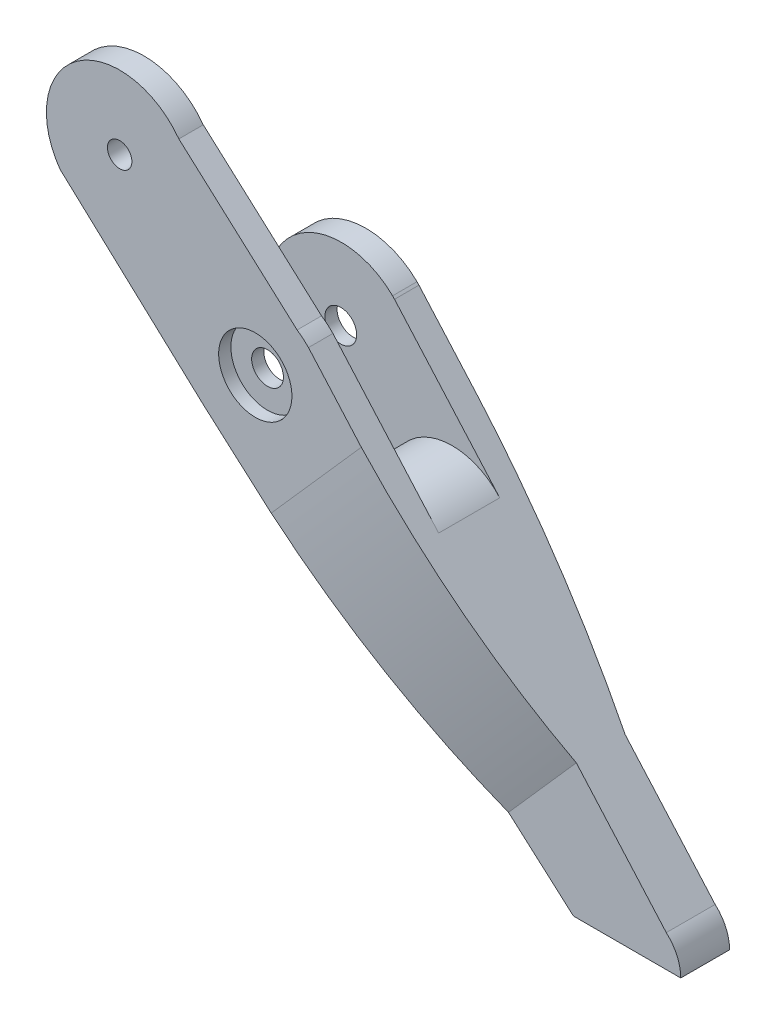
from build123d import *

# Parameters (mm, degrees)
BOSS_EXTRUDE1_DEPTH = 14
CUT_EXTRUDE1_DEPTH  = 17
CUT_EXTRUDE3_DEPTH  = 10
CUT_EXTRUDE5_DEPTH  = 28.00000000000001
BOSS_EXTRUDE2_START = 10
SKETCH7_R           = 2.599999999999999
BOSS_EXTRUDE2_DEPTH = 4
BOSS_EXTRUDE3_DEPTH = 24.000000000000014
CUT_EXTRUDE6_DEPTH  = 24.000000000000014
FILLET3_R           = 10.371224
SKETCH11_R          = 2.0000000000000036
BOSS_EXTRUDE4_DEPTH = 4.0000000000000036
SKETCH12_R          = 5.999999999999998
CUT_EXTRUDE7_DEPTH  = 2
CUT_EXTRUDE8_START  = -2
SKETCH13_R          = 6.000000000000001
CUT_EXTRUDE8_DEPTH  = 2


with BuildPart() as part:
    # Sketch1 → Boss-Extrude1 (new body)
    with BuildSketch(Plane.XY):
        with BuildLine():
            Line((-36.38946679579018, 35.15986129833476), (18.20052051694879, -13.03747639081095))
            Line((18.20052051694879, -13.03747639081095), (35.77692020217122, -13.037476390810937))
            ThreePointArc((35.77692020217122, -13.037476390810937), (35.15777812721451, -10.159169225075718), (33.40987673348322, -7.79002807961883))
            Line((33.40987673348322, -7.79002807961883), (-19.19377778956647, 51.90227090989418))
            ThreePointArc((-19.19377778956647, 51.90227090989418), (-36.16282709845803, 52.12891060722632), (-36.38946679579018, 35.15986129833476))
        make_face()
    extrude(amount=BOSS_EXTRUDE1_DEPTH)

    # Sketch2 → Cut-Extrude1 (cut)
    with BuildSketch(Plane.XY.offset(14)):
        with BuildLine():
            ThreePointArc((-26.066464510259447, 45.48286358386564), (-29.74341977242946, 45.48286358386556), (-29.74341977242945, 41.80590832169555))
            Line((-29.74341977242943, 41.80590832169553), (-26.066464510259397, 45.48286358386558))
        make_face()
        with BuildLine():
            Line((-26.066464510259397, 45.48286358386558), (-29.74341977242943, 41.80590832169553))
            ThreePointArc((-29.74341977242945, 41.805908321695554), (-26.90996521719519, 41.24229916825121), (-25.304942141344416, 43.64438595278056))
            ThreePointArc((-25.304942141344416, 43.64438595278056), (-25.502855356815083, 44.63936287692983), (-26.066464510259447, 45.48286358386564))
        make_face()
    extrude(amount=-CUT_EXTRUDE1_DEPTH, mode=Mode.SUBTRACT)

    # Sketch3 → Cut-Extrude3 (cut)
    with BuildSketch(Plane(origin=(0, 0, 0), x_dir=(-1, 0, 0), z_dir=(0, 0, -1))):
        Polygon((9.244950076252596, 40.61278154184911), (25.60190789451236, 23.944622093291866), (43.70935849975749, 23.944622093291866), (43.70935849975749, 56.22709716223903), (9.244950076252595, 56.22709716223903), align=None)
    extrude(amount=-CUT_EXTRUDE3_DEPTH, mode=Mode.SUBTRACT)

    # Sketch4 → Cut-Extrude5 (cut)
    with BuildSketch(Plane(origin=(1.5041731974177077, 1.7036790764832412, 0), x_dir=(0.7496354730351515, -0.6618509330410925, 0), z_dir=(-0.6618509330410925, -0.7496354730351515, 0))):
        with BuildLine():
            Line((8.092649067523661, 8), (43.108918661974144, 8))
            Line((43.108918661974144, 8), (43.108918661974144, 14))
            Line((43.108918661974144, 14), (-35.75655339767276, 14))
            add(Edge.make_bspline(
                [(8.092649067523661, 8), (-13.064100153172822, 13.584073422401662), (-35.75655339767276, 14)],
                knots=[0, 0, 0, 1, 1, 1], degree=2))
        make_face()
    extrude(amount=-CUT_EXTRUDE5_DEPTH, mode=Mode.SUBTRACT)



with BuildPart() as body_2:
    # Sketch7 → Boss-Extrude2 (new body)
    with BuildSketch(Plane(origin=(0, 0, 10), x_dir=(-1, 0, 0), z_dir=(0, 0, -1)).offset(BOSS_EXTRUDE2_START)):
        with BuildLine():
            Line((9.244950076252595, 40.61278154184911), (24.71284152511152, 24.85060352151197))
            Line((24.71284152511152, 24.85060352151197), (35.272794661727836, 34.17395478721706))
            Line((35.272794661727836, 34.17395478721706), (36.38946679579018, 35.15986129833476))
            ThreePointArc((36.38946679579018, 35.15986129833476), (36.27690366691708, 52.016347478352856), (19.420417486898984, 52.12891060722668))
            ThreePointArc((19.420417486898984, 52.128910607226686), (19.259089791001077, 51.96445532507904), (19.10094915036315, 51.79693307859034))
            Line((19.10094915036315, 51.79693307859034), (18.710021655268264, 51.3533258590539))
            Line((18.710021655268264, 51.3533258590539), (9.244950076252596, 40.61278154184911))
        make_face()
        with Locations(Location((27.904942141344414, 43.64438595278056, 0), (0, 0, 180))):
            Circle(SKETCH7_R, mode=Mode.SUBTRACT)
    extrude(amount=BOSS_EXTRUDE2_DEPTH)


with BuildPart() as part_1:
    add(part.part)

    add(body_2.part)  # Boss-Extrude3 merges body 2
    # Sketch9 → Boss-Extrude3 (add)
    with BuildSketch(Plane(origin=(14.941459139681696, 13.167114819822281, 0), x_dir=(0, 0, -1), z_dir=(0.7502493779859964, 0.6611549522098625, 0))):
        with BuildLine():
            Line((0, 36.582058615900806), (0, -5.650867010397978))
            add(Edge.make_bspline(
                [(0, -5.650867010397978), (3.8818367436513204, 15.308651069653255), (4, 36.582058615900806)],
                knots=[0, 0, 0, 1, 1, 1], degree=2))
            Line((4, 36.582058615900806), (0, 36.582058615900806))
        make_face()
    extrude(amount=-BOSS_EXTRUDE3_DEPTH)

    # Sketch10 → Cut-Extrude6 (cut)
    with BuildSketch(Plane.XY):
        Polygon((-25.92087579699025, 25.91717339280068), (6.581343150758677, -2.7789391982650153), (-1.9207549102098282, -11.21281031813962), (-35.1442259060093, 19.61838673287275), align=None)
    extrude(amount=-CUT_EXTRUDE6_DEPTH, mode=Mode.SUBTRACT)

    # Fillet3
    fillet3_edges = [part_1.edges().sort_by_distance(p)[0] for p in [
        (-24.712841525111525, 24.85060352151197, 5),
        (-9.244950076252596, 40.61278154184911, 5),
    ]]
    fillet(fillet3_edges, radius=FILLET3_R - 0.0001)  # a hair under: the kernel refuses the full size

    # Sketch11 → Boss-Extrude4 (add)
    with BuildSketch(Plane.XY.offset(14)):
        with BuildLine():
            Line((-56.27002242528391, 53.500762526462196), (-36.38946679579018, 35.15986129833476))
            Line((-36.38946679579018, 35.15986129833476), (-31.30885180689802, 50.34187338631568))
            Line((-31.30885180689802, 50.34187338631568), (-18.71002165526834, 51.353325859054))
            Line((-18.71002165526834, 51.353325859054), (-40.42419503361445, 70.87498928012118))
            ThreePointArc((-40.42419503361445, 70.87498928012118), (-57.13470265149496, 73.54200286861439), (-59.89717634802535, 56.84701064326646))
            Line((-59.89717634802535, 56.84701064326646), (-56.27002242528391, 53.500762526462196))
        make_face()
        with Locations((-50.120598780049356, 63.8053531942874)):
            Circle(SKETCH11_R, mode=Mode.SUBTRACT)
    extrude(amount=-BOSS_EXTRUDE4_DEPTH)

    # Sketch12 → Cut-Extrude7 (cut)
    with BuildSketch(Plane(origin=(0, 0, -4), x_dir=(-1, 0, 0), z_dir=(0, 0, -1))):
        with Locations((27.904942141344414, 43.64438595278056)):
            Circle(SKETCH12_R)
    extrude(amount=-CUT_EXTRUDE7_DEPTH, mode=Mode.SUBTRACT)

    # Sketch13 → Cut-Extrude8 (cut)
    with BuildSketch(Plane.XY.offset(14).offset(CUT_EXTRUDE8_START)):
        with Locations(Location((-27.904942141344414, 43.64438595278056, 0), (0, 0, 180))):
            Circle(SKETCH13_R)
    extrude(amount=CUT_EXTRUDE8_DEPTH, mode=Mode.SUBTRACT)


solid = part_1.part
